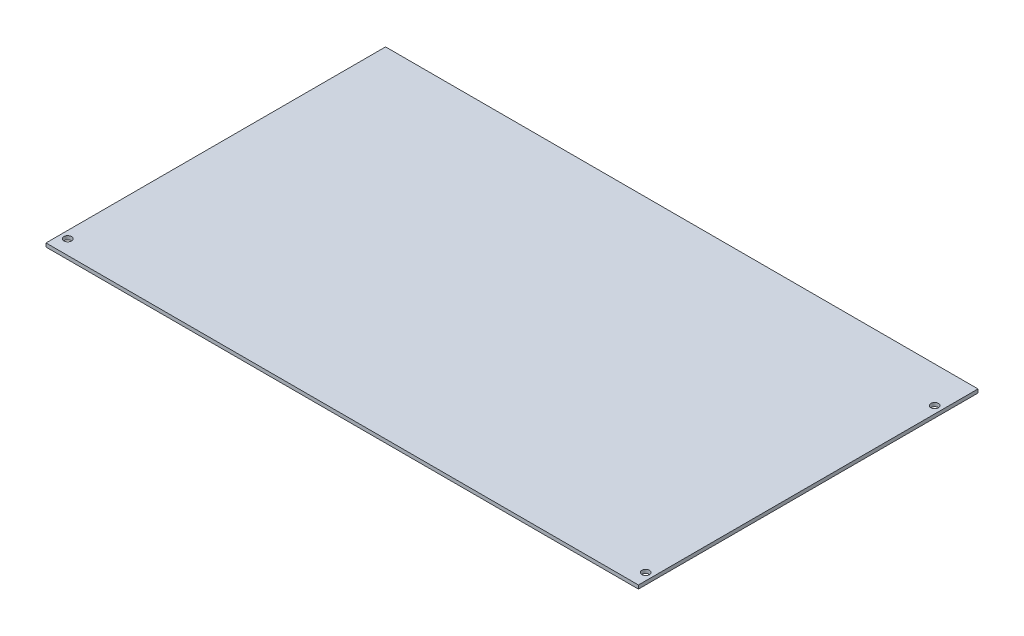
from build123d import *

# Parameters (mm, degrees)
SKETCH1_W           = 520.7
SKETCH1_H           = 298.45
BOSS_EXTRUDE1_DEPTH = 3.175
CUT_EXTRUDE1_REACH  = 602.176
SKETCH2_R           = 3.3528


with BuildPart() as part:
    # Sketch1 → Boss-Extrude1 (new body)
    with BuildSketch(Plane(origin=(0, 0, 0), x_dir=(1, 0, 0), z_dir=(0, 1, 0))):
        with Locations((260.35, 149.225)):
            Rectangle(SKETCH1_W, SKETCH1_H)
    extrude(amount=BOSS_EXTRUDE1_DEPTH)

    # Sketch2 → Cut-Extrude1 (cut, up to next)
    with BuildSketch(Plane.XZ, mode=Mode.PRIVATE) as cut_extrude1_sk1:
        with Locations((6.35, -12.7)):
            Circle(SKETCH2_R)
    cut_extrude1_tool1 = extrude(cut_extrude1_sk1.sketch, amount=-CUT_EXTRUDE1_REACH, mode=Mode.PRIVATE) & part.part
    # Sketch2 → Cut-Extrude1 (cut, up to next)
    with BuildSketch(Plane.XZ, mode=Mode.PRIVATE) as cut_extrude1_sk2:
        with Locations((514.35, -12.7)):
            Circle(SKETCH2_R)
    cut_extrude1_tool2 = extrude(cut_extrude1_sk2.sketch, amount=-CUT_EXTRUDE1_REACH, mode=Mode.PRIVATE) & part.part
    # Sketch2 → Cut-Extrude1 (cut, up to next)
    with BuildSketch(Plane.XZ, mode=Mode.PRIVATE) as cut_extrude1_sk3:
        with Locations((514.35, -266.7)):
            Circle(SKETCH2_R)
    cut_extrude1_tool3 = extrude(cut_extrude1_sk3.sketch, amount=-CUT_EXTRUDE1_REACH, mode=Mode.PRIVATE) & part.part
    add(cut_extrude1_tool1.solids().sort_by_distance((6.35, 0, -12.7))[0], mode=Mode.SUBTRACT)
    add(cut_extrude1_tool2.solids().sort_by_distance((514.35, 0, -12.7))[0], mode=Mode.SUBTRACT)
    add(cut_extrude1_tool3.solids().sort_by_distance((514.35, 0, -266.7))[0], mode=Mode.SUBTRACT)


solid = part.part
